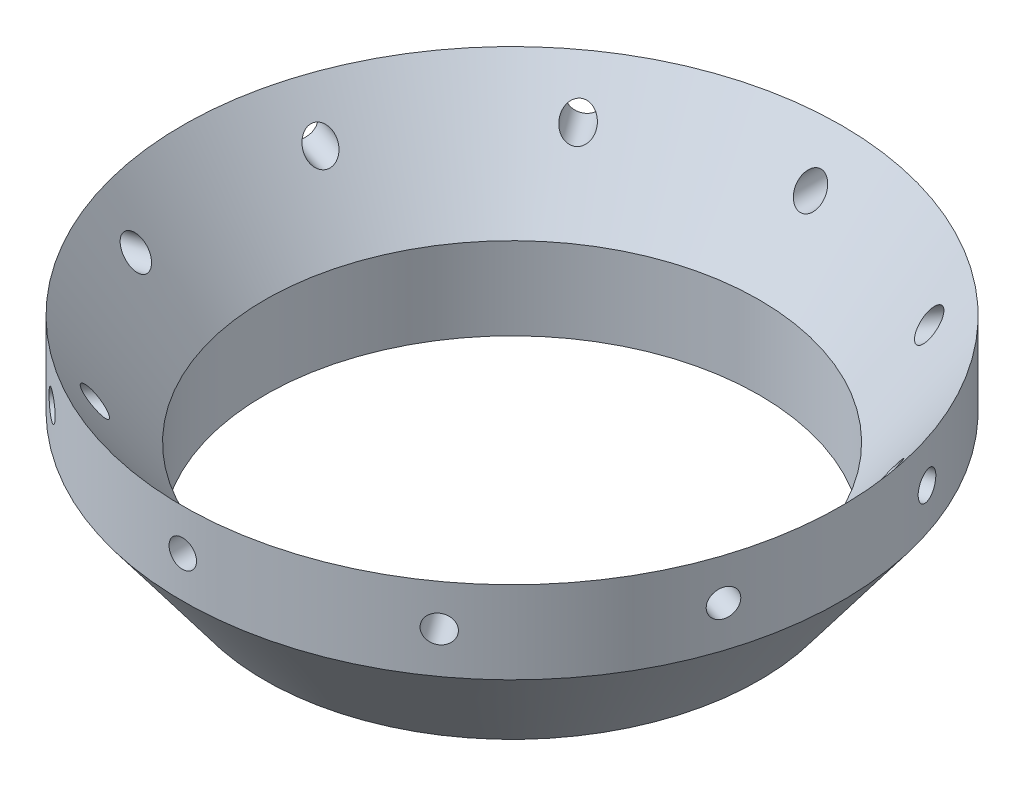
from build123d import *

# Parameters (mm, degrees)
SKETCH2_R          = 3.175
CUT_EXTRUDE1_DEPTH = 267.514272105
CIRPATTERN1_COUNT  = 10


with BuildPart() as part:
    # Sketch1 → Revolve1 (revolve)
    with BuildSketch(Plane.XY):
        Polygon((-57.15, 199.305978871), (-57.15, 218.355978871), (-76.2, 243.755978871), (-76.2, 224.705978871), align=None)
    revolve(axis=Axis((0, 0, 0), (0, 1, 0)))

    # Sketch2 → Cut-Extrude1 (cut, through all)
    with BuildSketch(Plane.XY):
        with Locations((0, 234.230978871)):
            Circle(SKETCH2_R)
    cut_extrude1 = extrude(amount=-CUT_EXTRUDE1_DEPTH, mode=Mode.SUBTRACT)

    # CirPattern1: Cut-Extrude1 ×10 about axis
    cirpattern1_axis = Axis((0, 235.80346447, 0), (0, -1, 0))
    for i in range(1, CIRPATTERN1_COUNT):
        add(cut_extrude1.rotate(cirpattern1_axis, i * 360 / CIRPATTERN1_COUNT), mode=Mode.SUBTRACT)


solid = part.part
